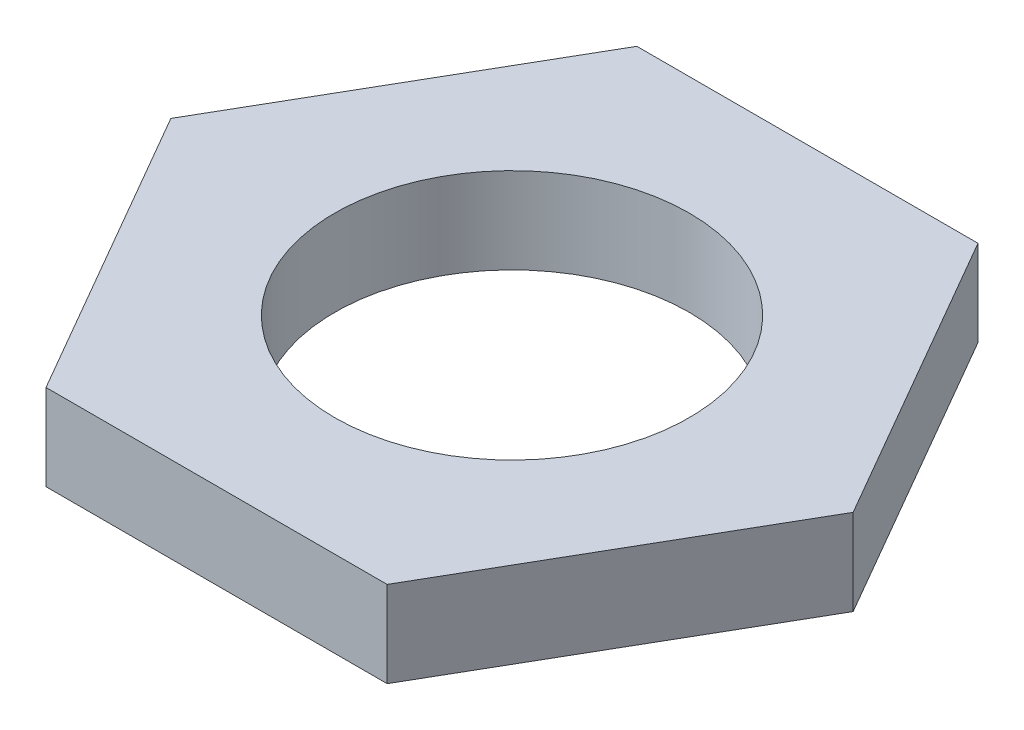
from build123d import *

# Parameters (mm, degrees)
SKETCH1_R           = 4.7625
BOSS_EXTRUDE1_DEPTH = 2.31


with BuildPart() as part:
    # Sketch1 → Boss-Extrude1 (new body)
    with BuildSketch(Plane(origin=(0, 0, 0), x_dir=(1, 0, 0), z_dir=(0, 1, 0))):
        Polygon((-4.582717762, -7.9375), (4.582717762, -7.9375), (9.165435523, 0), (4.582717762, 7.9375), (-4.582717762, 7.9375), (-9.165435523, 0), align=None)
        Circle(SKETCH1_R, mode=Mode.SUBTRACT)
    extrude(amount=BOSS_EXTRUDE1_DEPTH)


solid = part.part
